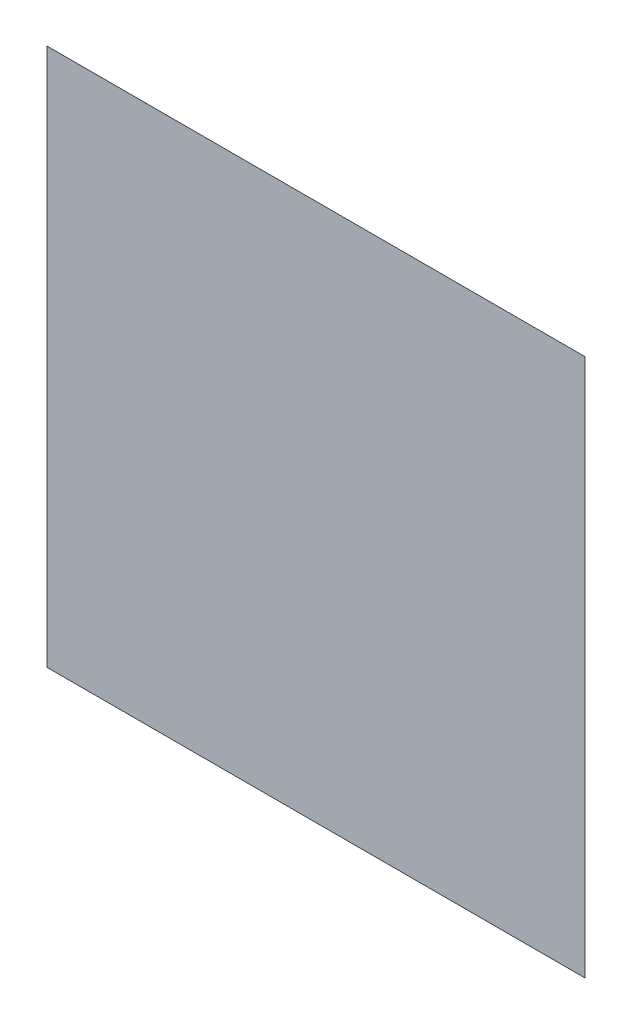
from build123d import *

# Parameters (mm, degrees)
BOSS_EXTRU_1_DEPTH      = 0.025
BOSS_EXTRU_1_DEPTH_BACK = 0.025
ESQUISSE1_W             = 10000
ESQUISSE1_H             = 10000


with BuildPart() as part:
    # Esquisse1 → Boss.-Extru.1 (new, two sides: drawn at the far end of the back side and taken through both)
    with BuildSketch(Plane.XY.offset(-BOSS_EXTRU_1_DEPTH_BACK)):
        Rectangle(ESQUISSE1_W, ESQUISSE1_H)
    extrude(amount=BOSS_EXTRU_1_DEPTH + BOSS_EXTRU_1_DEPTH_BACK)


solid = part.part
